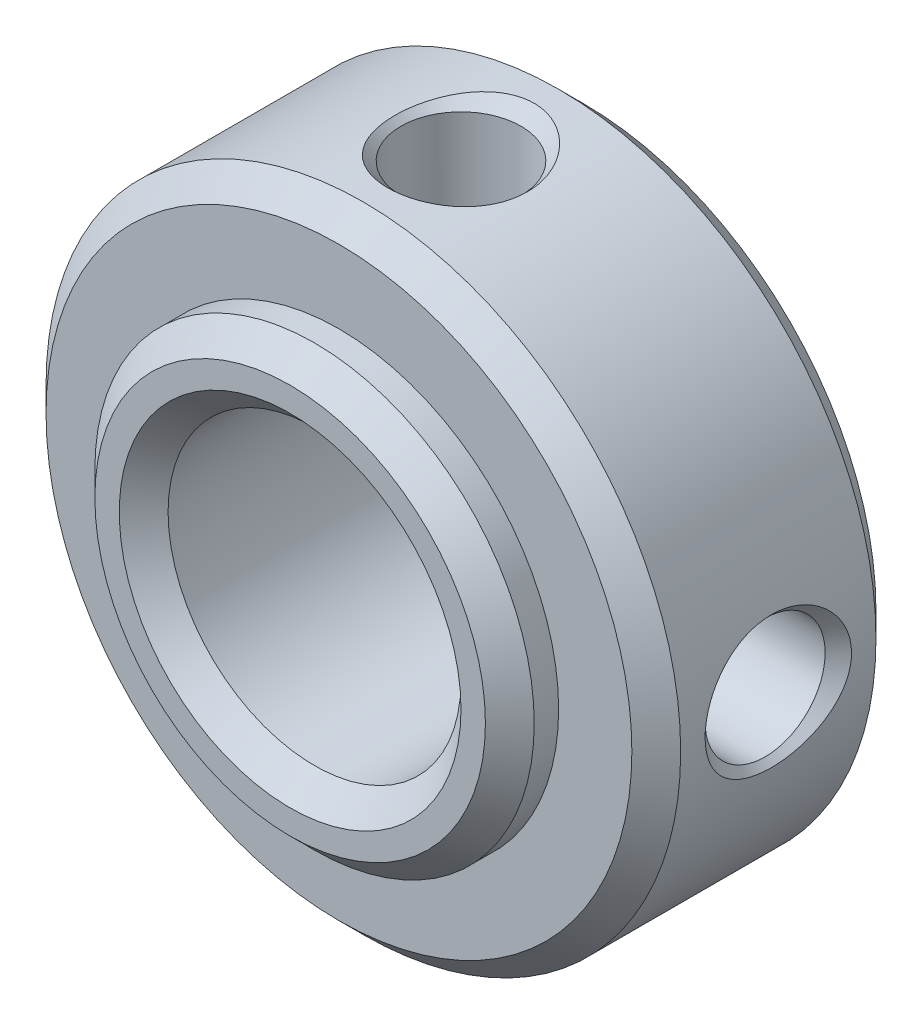
from build123d import *


with BuildPart() as part:
    # Esquisse1 → Révolution1 (revolve)
    with BuildSketch(Plane(origin=(0, 0, 0), x_dir=(1, 0, 0), z_dir=(0, 1, 0))):
        Polygon((3, 2), (3, -3), (3.5, -3.5), (4, -3.5), (4.5, -3), (4.5, -2.5), (6, -2.5), (6.5, -2), (6.5, 2), (6, 2.5), (3.5, 2.5), align=None)
    revolve(axis=Axis((0, 0, 3.5), (0, 0, -1)))

    # Esquisse2 → Enlèvement de matière-Révolution1 (revolve, cut)
    with BuildSketch(Plane.XY):
        Polygon((2, 0), (2, 1.2295), (6.2295, 1.2295), (6.5, 1.5), (6.5, 0), align=None)
    revolve(axis=Axis((6.5, 0, 0), (-1, 0, 0)), mode=Mode.SUBTRACT)

    # Esquisse3 → Enlèvement de matière-Révolution2 (revolve, cut)
    with BuildSketch(Plane.XY):
        Polygon((0, 2), (-1.2295, 2), (-1.2295, 6.2295), (-1.5, 6.5), (0, 6.5), align=None)
    revolve(axis=Axis((0, 6.5, 0), (0, -1, 0)), mode=Mode.SUBTRACT)


solid = part.part
